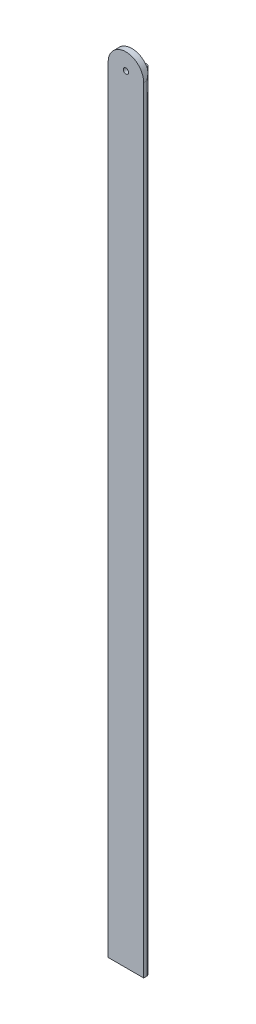
from build123d import *

# Parameters (mm, degrees)
BOSS_EXTRUDE1_DEPTH = 431.8
SKETCH4_W           = 15.875
SKETCH4_H           = 25.4
CUT_EXTRUDE1_DEPTH  = 6.35
SKETCH5_W           = 1.5875
SKETCH5_H           = 25.4
CUT_EXTRUDE2_DEPTH  = 6.35
SKETCH6_R           = 1.4224
CUT_EXTRUDE3_DEPTH  = 5.08
CUT_EXTRUDE4_START  = -6.35
CUT_EXTRUDE4_DEPTH  = 6.35
SKETCH8_R           = 1.4224
CUT_EXTRUDE5_DEPTH  = 5.08
CUT_EXTRUDE7_DEPTH  = 5.08


with BuildPart() as part:
    # Sketch2 → Boss-Extrude1 (new body)
    with BuildSketch(Plane(origin=(0, 0, 0), x_dir=(1, 0, 0), z_dir=(0, 1, 0))):
        with BuildLine():
            Line((0, 0), (19.05, 0))
            Line((19.05, 0), (19.05, 1.5875))
            ThreePointArc((19.05, 1.5875), (18.585032015, 2.710032015), (17.4625, 3.175))
            Line((17.4625, 3.175), (4.7625, 3.175))
            ThreePointArc((4.7625, 3.175), (3.639967985, 3.639967985), (3.175, 4.7625))
            Line((3.175, 4.7625), (3.175, 17.4625))
            ThreePointArc((3.175, 17.4625), (2.710032015, 18.585032015), (1.5875, 19.05))
            Line((1.5875, 19.05), (0, 19.05))
            Line((0, 19.05), (0, 0))
        make_face()
    extrude(amount=BOSS_EXTRUDE1_DEPTH)

    # Sketch4 → Cut-Extrude1 (cut)
    with BuildSketch(Plane(origin=(3.175, 0, 0), x_dir=(0, 0, -1), z_dir=(1, 0, 0))):
        with Locations((11.1125, 419.1)):
            Rectangle(SKETCH4_W, SKETCH4_H)
    extrude(amount=-CUT_EXTRUDE1_DEPTH, mode=Mode.SUBTRACT)

    # Sketch5 → Cut-Extrude2 (cut)
    with BuildSketch(Plane.ZY.offset(-3.175)):
        with Locations((-3.96875, 419.1)):
            Rectangle(SKETCH5_W, SKETCH5_H)
    extrude(amount=-CUT_EXTRUDE2_DEPTH, mode=Mode.SUBTRACT)

    # Sketch6 → Cut-Extrude3 (cut)
    with BuildSketch(Plane(origin=(3.175, 0, 0), x_dir=(0, 0, -1), z_dir=(1, 0, 0))):
        with Locations((11.1125, 109.5375)):
            Circle(SKETCH6_R)
        with Locations((11.1125, 203.2)):
            Circle(SKETCH6_R)
        with Locations((11.1125, 296.8625)):
            Circle(SKETCH6_R)
        with Locations((11.1125, 11.1125)):
            Circle(SKETCH6_R)
        with Locations((11.1125, 395.2875)):
            Circle(SKETCH6_R)
    extrude(amount=-CUT_EXTRUDE3_DEPTH, mode=Mode.SUBTRACT)

    # Sketch7 → Cut-Extrude4 (cut)
    with BuildSketch(Plane(origin=(0, 431.8, 0), x_dir=(1, 0, 0), z_dir=(0, 1, 0)).offset(CUT_EXTRUDE4_START)):
        with BuildLine():
            Line((17.4625, 3.175), (0, 3.175))
            Line((0, 3.175), (0, 0))
            Line((0, 0), (19.05, 0))
            Line((19.05, 0), (19.05, 1.5875))
            ThreePointArc((19.05, 1.5875), (18.585032015, 2.710032015), (17.4625, 3.175))
        make_face()
    extrude(amount=CUT_EXTRUDE4_DEPTH, mode=Mode.SUBTRACT)

    # Sketch8 → Cut-Extrude5 (cut)
    with BuildSketch(Plane(origin=(0, 0, -3.175), x_dir=(-1, 0, 0), z_dir=(0, 0, -1))):
        with Locations((-9.525, 416.56)):
            Circle(SKETCH8_R)
    extrude(amount=-CUT_EXTRUDE5_DEPTH, mode=Mode.SUBTRACT)

    # Sketch10 → Cut-Extrude7 (cut)
    with BuildSketch(Plane(origin=(0, 0, -3.175), x_dir=(-1, 0, 0), z_dir=(0, 0, -1))):
        with BuildLine():
            Line((0, 425.45), (-9.525, 425.45))
            ThreePointArc((-9.525, 425.45), (-2.789807909, 422.660192091), (0, 415.925))
            Line((0, 415.925), (0, 425.45))
        make_face()
        with BuildLine():
            Line((-19.05, 425.45), (-19.05, 415.925))
            ThreePointArc((-19.05, 415.925), (-16.260192091, 422.660192091), (-9.525, 425.45))
            Line((-9.525, 425.45), (-19.05, 425.45))
        make_face()
    extrude(amount=-CUT_EXTRUDE7_DEPTH, mode=Mode.SUBTRACT)


solid = part.part
